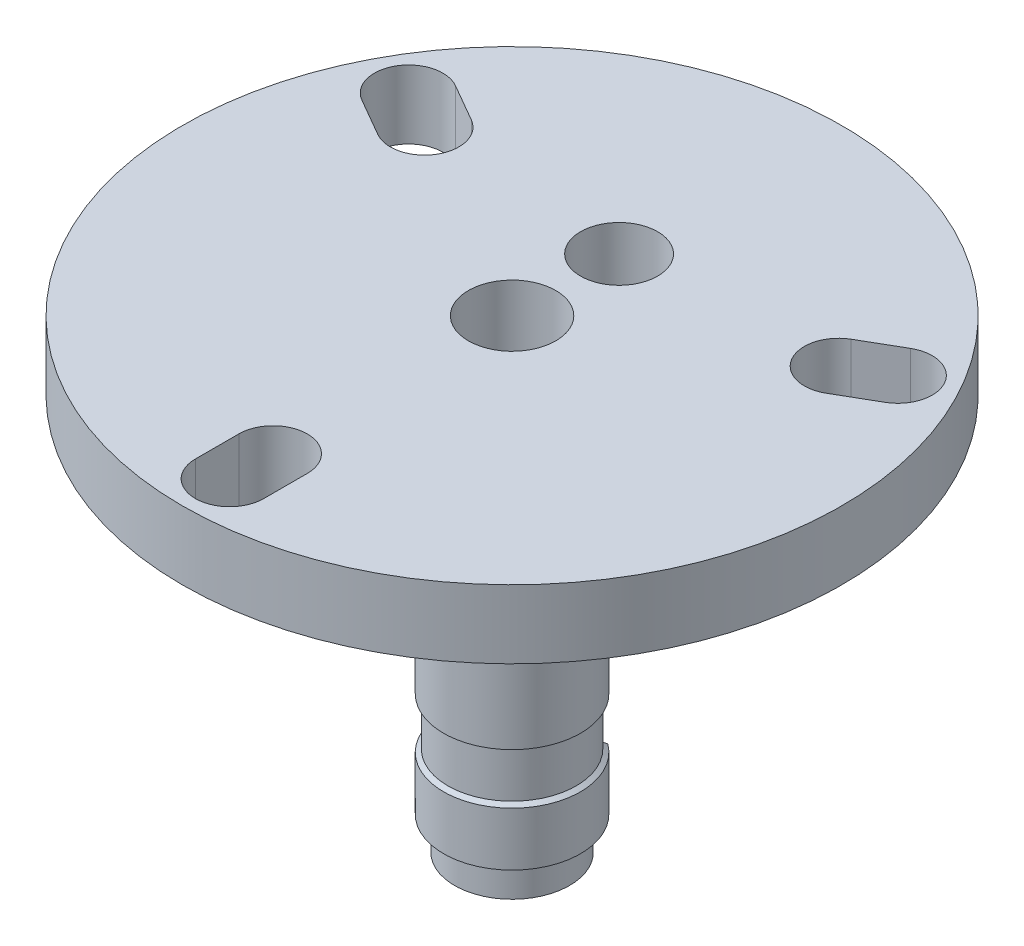
from build123d import *

# Parameters (mm, degrees)
SKETCH1_R           = 19.25
SKETCH1_R_2         = 4
BOSS_EXTRUDE1_DEPTH = 4
SKETCH1_4_R         = 4
BOSS_EXTRUDE2_DEPTH = 27.15
CUT_EXTRUDE1_START  = -1.932
SKETCH6_R           = 4
SKETCH6_R_2         = 3.356
CUT_EXTRUDE1_DEPTH  = 1.932
SKETCH7_R           = 2.25
CUT_EXTRUDE2_DEPTH  = 36.735801376
SKETCH8_R           = 2.5
CUT_EXTRUDE3_DEPTH  = 5
CHAMFER1_SIZE       = 2
CHAMFER1_SIZE2      = 0.727940469
SKETCH9_W           = 0.25
SKETCH9_H           = 2.75
CHAMFER3_SIZE       = 0.3
CHAMFER3_SIZE_2     = 0.210062261


with BuildPart() as part:
    # Sketch1 → Boss-Extrude1 (new body)
    # profile 1 of 2: a face of its own
    with BuildSketch(Plane(origin=(0, 0, 0), x_dir=(1, 0, 0), z_dir=(0, 1, 0))):
        with Locations(Location((0, 0, 0), (0, 0, 270))):
            Circle(SKETCH1_R)
        with BuildLine():
            ThreePointArc((2, -16.5), (0, -18.5), (-2, -16.5))
            Line((-2, -16.5), (-2, -16.378339354))
            ThreePointArc((-2, -16.378339354), (-14.289419162, -8.25), (-15.184057953, 6.45711887))
            Line((-15.184057953, 6.45711887), (-15.289419162, 6.517949192))
            ThreePointArc((-15.289419162, 6.517949192), (-16.02146997, 9.25), (-13.289419162, 9.982050808))
            Line((-13.289419162, 9.982050808), (-13.184057953, 9.921220485))
            ThreePointArc((-13.184057953, 9.921220485), (0, 16.5), (13.184057953, 9.921220485))
            Line((13.184057953, 9.921220485), (13.289419162, 9.982050808))
            ThreePointArc((13.289419162, 9.982050808), (16.02146997, 9.25), (15.289419162, 6.517949192))
            Line((15.289419162, 6.517949192), (15.184057953, 6.45711887))
            ThreePointArc((15.184057953, 6.45711887), (16.167667677, 3.294923655), (16.5, 0))
            ThreePointArc((16.5, 0), (12.354149101, -10.937321427), (2, -16.378339354))
            Line((2, -16.378339354), (2, -16.5))
        make_face(mode=Mode.SUBTRACT)
    # profile 2 of 2: a face of its own
    with BuildSketch(Plane(origin=(0, 0, 0), x_dir=(1, 0, 0), z_dir=(0, 1, 0))):
        with BuildLine():
            ThreePointArc((-15.184057953, 6.45711887), (-14.289419162, -8.25), (-2, -16.378339354))
            Line((-2, -16.378339354), (-2, -13.96))
            ThreePointArc((-2, -13.96), (0, -11.96), (2, -13.96))
            Line((2, -13.96), (2, -16.378339354))
            ThreePointArc((2, -16.378339354), (12.354149101, -10.937321427), (16.5, 0))
            ThreePointArc((16.5, 0), (16.167667677, 3.294923655), (15.184057953, 6.45711887))
            Line((15.184057953, 6.45711887), (13.089714637, 5.247949192))
            ThreePointArc((13.089714637, 5.247949192), (10.357663829, 5.98), (11.089714637, 8.712050808))
            Line((11.089714637, 8.712050808), (13.184057953, 9.921220485))
            ThreePointArc((13.184057953, 9.921220485), (0, 16.5), (-13.184057953, 9.921220485))
            Line((-13.184057953, 9.921220485), (-11.094979939, 8.715090731))
            Line((-11.094979939, 8.715090731), (-11.089714637, 8.712050808))
            ThreePointArc((-11.089714637, 8.712050808), (-10.357663829, 5.98), (-13.089714637, 5.247949192))
            Line((-13.089714637, 5.247949192), (-15.184057953, 6.45711887))
        make_face()
        with Locations(Location((0, 0, 0), (0, 0, 270))):
            Circle(SKETCH1_R_2, mode=Mode.SUBTRACT)
    extrude(amount=-BOSS_EXTRUDE1_DEPTH)

    # Sketch1<4> → Boss-Extrude2 (add)
    with BuildSketch(Plane(origin=(0, 0, 0), x_dir=(1, 0, 0), z_dir=(0, 1, 0))):
        with Locations(Location((0, 0, 0), (0, 0, 270))):
            Circle(SKETCH1_4_R)
    extrude(amount=-BOSS_EXTRUDE2_DEPTH)

    # Sketch2 → Cut-Revolve4 (revolve, cut)
    with BuildSketch(Plane(origin=(0, 0, 0), x_dir=(0, 0, -1), z_dir=(1, 0, 0)), mode=Mode.PRIVATE) as cut_revolve4_sk:
        Polygon((0, -27.15), (0.8, -27.15), (0.8, -25.15), (1, 0), (0, 0), align=None)
    revolve(cut_revolve4_sk.sketch.rotate(Axis((0, 0, 0), (0, -1, 0)), 180), axis=Axis((0, 0, 0), (0, -1, 0)), mode=Mode.SUBTRACT)

    # Sketch5 → Cut-Revolve8 (revolve, cut)
    with BuildSketch(Plane.XY, mode=Mode.PRIVATE) as cut_revolve8_sk:
        Polygon((0, -7), (-2.55, -5.527756814), (-2.55, 0), (0, 0), align=None)
    revolve(cut_revolve8_sk.sketch.rotate(Axis((0, 0, 0), (0, -1, 0)), 270), axis=Axis((0, 0, 0), (0, -1, 0)), mode=Mode.SUBTRACT)

    # Sketch6 → Cut-Extrude1 (cut)
    with BuildSketch(Plane.XZ.offset(27.15).offset(CUT_EXTRUDE1_START)):
        with Locations(Location((0, 0, 0), (0, 0, 90))):
            Circle(SKETCH6_R)
        with Locations(Location((0, 0, 0), (0, 0, 270))):
            Circle(SKETCH6_R_2, mode=Mode.SUBTRACT)
    extrude(amount=CUT_EXTRUDE1_DEPTH, mode=Mode.SUBTRACT)

    # Sketch7 → Cut-Extrude2 (cut, through all)
    with BuildSketch(Plane.XZ.offset(4)):
        with Locations(Location((0, -6.25, 0), (0, 0, 270))):
            Circle(SKETCH7_R)
    extrude(amount=-CUT_EXTRUDE2_DEPTH, mode=Mode.SUBTRACT)

    # Sketch8 → Cut-Extrude3 (cut)
    with BuildSketch(Plane(origin=(0, -23, 0), x_dir=(1, 0, 0), z_dir=(0, 1, 0))):
        with Locations((0, 4)):
            Circle(SKETCH8_R)
    extrude(amount=CUT_EXTRUDE3_DEPTH, mode=Mode.SUBTRACT)

    # Chamfer1
    chamfer1_edges = [part.edges().sort_by_distance(p)[0] for p in [
        (0, -18, -4),
    ]]
    chamfer1_side = [part.faces().sort_by_distance(p)[0] for p in [
        (0, -14.609, -4),
    ]]
    chamfer(chamfer1_edges, length=CHAMFER1_SIZE, length2=CHAMFER1_SIZE2, reference=chamfer1_side[0])

    # Sketch9 → Cut-Revolve9 (revolve, cut)
    with BuildSketch(Plane(origin=(0, 0, 0), x_dir=(0, 0, -1), z_dir=(1, 0, 0)), mode=Mode.PRIVATE) as cut_revolve9_sk:
        with Locations((-3.875, -20.5)):
            Rectangle(SKETCH9_W, SKETCH9_H)
    revolve(cut_revolve9_sk.sketch.rotate(Axis((0, -27.15, 0), (0, 1, 0)), 143.580086271), axis=Axis((0, -27.15, 0), (0, 1, 0)), mode=Mode.SUBTRACT)

    # Chamfer3
    # the kernel refuses this chamfer: 0.3, 0.210062261 mm, written as the material it takes off along each edge
    with BuildSketch(Plane(origin=(0, -21.875, 0), x_dir=(-0.42752924874280274, 0, -0.9040015162981834), z_dir=(0.9040015162981834, 0, -0.42752924874280274))) as chamfer3_piece_1_section:
        Polygon((4 - CHAMFER3_SIZE, 0), (4, -CHAMFER3_SIZE_2 * 1.0000000022), (4, 0), align=None)
    chamfer3_piece_1 = revolve(axis=Axis((0, -21.875, 0), (0, 1, 0)), revolution_arc=154.689138052, mode=Mode.PRIVATE)
    chamfer3_piece_1 = chamfer3_piece_1 - Plane(origin=(0, -21.995167344, 0), x_dir=(0.593698599754949, 0, -0.8046874999955033), z_dir=(0, -1, 0)) * Cylinder(3.75, 16, mode=Mode.PRIVATE)
    add(chamfer3_piece_1, mode=Mode.SUBTRACT)
    with BuildSketch(Plane(origin=(0, -21.875, 0), x_dir=(0, 0, 1), z_dir=(-1, 0, 0))) as chamfer3_piece_2_section:
        Polygon((4 - CHAMFER3_SIZE, 0), (4, -CHAMFER3_SIZE_2 * 1.0000000022), (4, 0), align=None)
    chamfer3_piece_2 = revolve(axis=Axis((0, -21.875, 0), (0, 1, 0)), revolution_arc=154.689138052, mode=Mode.PRIVATE)
    chamfer3_piece_2 = chamfer3_piece_2 - Plane(origin=(0, -21.995167344, 0), x_dir=(0.593698599754949, 0, -0.8046874999955033), z_dir=(0, -1, 0)) * Cylinder(3.75, 16, mode=Mode.PRIVATE)
    add(chamfer3_piece_2, mode=Mode.SUBTRACT)


solid = part.part
